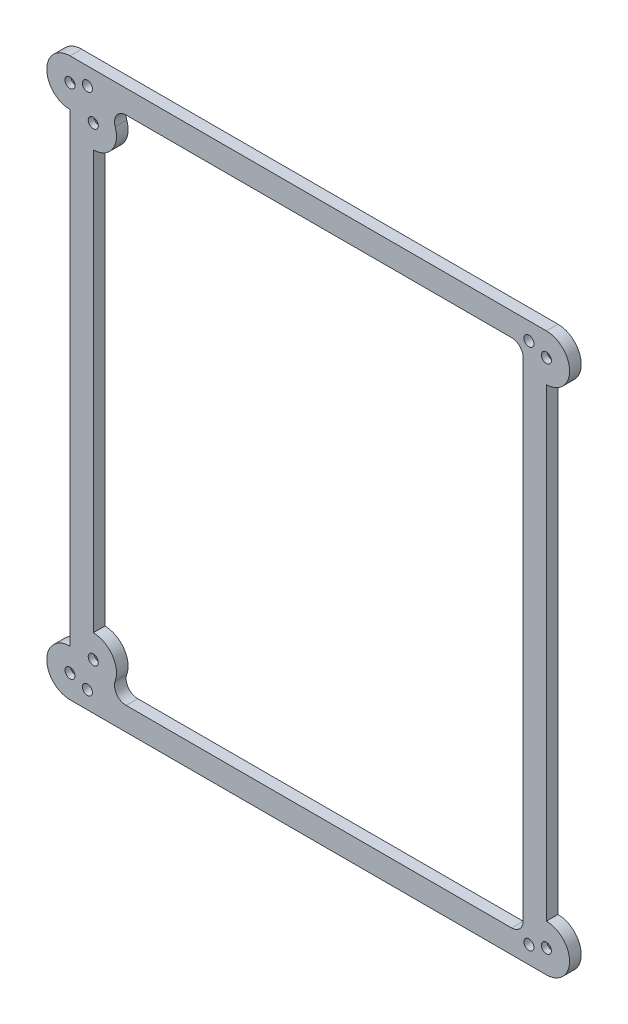
from build123d import *

# Parameters (mm, degrees)
SKETCH1_R           = 2.75
BOSS_EXTRUDE1_DEPTH = 6.35
FILLET1_R           = 6.35
CHAMFER1_SIZE       = 3.175


with BuildPart() as part:
    # Sketch1 → Boss-Extrude1 (new body)
    with BuildSketch(Plane.XY):
        with BuildLine():
            ThreePointArc((-19.05, 19.05), (-31.75, 6.35), (-19.05, -6.35))
            Line((-19.05, -6.35), (-19.05, -260.35))
            ThreePointArc((-19.05, -260.35), (-31.75, -273.05), (-19.05, -285.75))
            Line((-19.05, -285.75), (241.3, -285.75))
            ThreePointArc((241.3, -285.75), (254, -273.05), (241.3, -260.35))
            Line((241.3, -260.35), (241.3, -6.35))
            ThreePointArc((241.3, -6.35), (254, 6.35), (241.3, 19.05))
            Line((241.3, 19.05), (-19.05, 19.05))
        make_face()
        with Locations((241.3, 6.35)):
            Circle(SKETCH1_R, mode=Mode.SUBTRACT)
        with Locations((-19.05, -273.05)):
            Circle(SKETCH1_R, mode=Mode.SUBTRACT)
        with Locations((-9.525, -276.225)):
            Circle(SKETCH1_R, mode=Mode.SUBTRACT)
        with Locations((231.775, -276.225)):
            Circle(SKETCH1_R, mode=Mode.SUBTRACT)
        with Locations((241.3, -273.05)):
            Circle(SKETCH1_R, mode=Mode.SUBTRACT)
        with BuildLine():
            Line((-6.35, -247.65), (-6.35, -19.05))
            ThreePointArc((-6.35, -19.05), (6.35, -6.35), (-6.35, 6.35))
            Line((-6.35, 6.35), (228.6, 6.35))
            Line((228.6, 6.35), (228.6, -273.05))
            Line((228.6, -273.05), (-6.35, -273.05))
            ThreePointArc((-6.35, -273.05), (6.35, -260.35), (-6.35, -247.65))
        make_face(mode=Mode.SUBTRACT)
        with Locations((-6.35, -6.35)):
            Circle(SKETCH1_R, mode=Mode.SUBTRACT)
        with Locations((-6.35, -260.35)):
            Circle(SKETCH1_R, mode=Mode.SUBTRACT)
        with Locations((-19.05, 6.35)):
            Circle(SKETCH1_R, mode=Mode.SUBTRACT)
        with Locations((-9.525, 9.525)):
            Circle(SKETCH1_R, mode=Mode.SUBTRACT)
        with Locations((231.775, 9.525)):
            Circle(SKETCH1_R, mode=Mode.SUBTRACT)
    extrude(amount=BOSS_EXTRUDE1_DEPTH)

    # Fillet1
    fillet1_edges = [part.edges().sort_by_distance(p)[0] for p in [
        (228.6, -273.05, 3.175),
        (228.6, 6.35, 3.175),
        (-6.35, 6.35, 3.175),
    ]]
    fillet(fillet1_edges, radius=FILLET1_R)
    fillet1_2_edges = [part.edges().sort_by_distance(p)[0] for p in [
        (-6.35, -273.05, 3.175),
    ]]
    fillet(fillet1_2_edges, radius=FILLET1_R)

    # Chamfer1
    chamfer1_edges = [part.edges().sort_by_distance(p)[0] for p in [
        (-21.8, 6.35, 0),
        (-21.8, -273.05, 0),
        (238.55, 6.35, 0),
        (238.55, -273.05, 0),
        (-9.1, -260.35, 0),
        (-9.1, -6.35, 0),
    ]]
    chamfer(chamfer1_edges, length=CHAMFER1_SIZE)


solid = part.part
